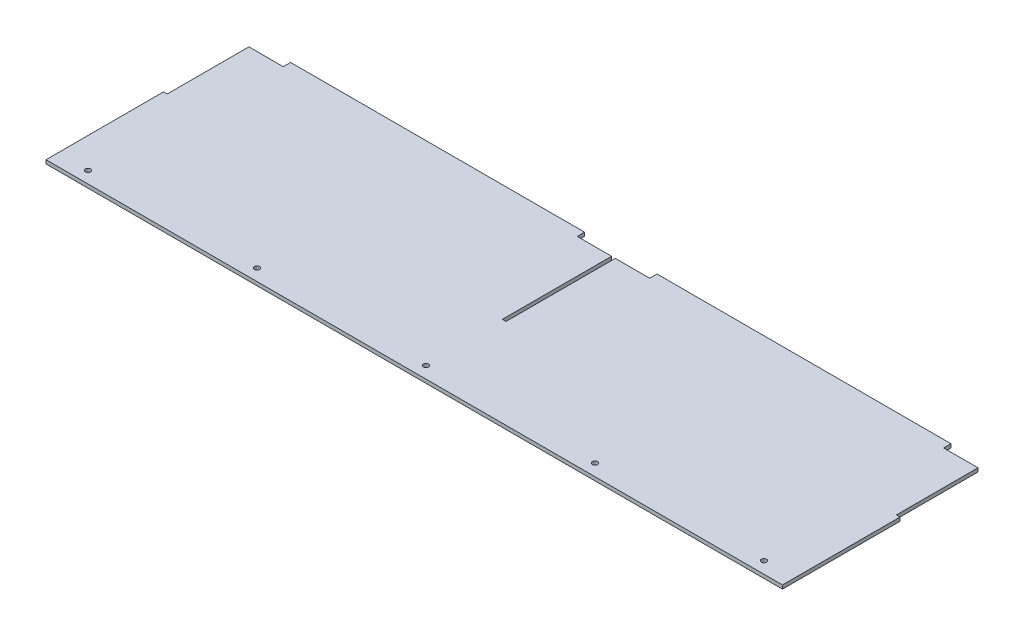
from build123d import *

# Parameters (mm, degrees)
SKETCH1_W           = 629.90984
SKETCH1_H           = 147.69846
BOSS_EXTRUDE1_DEPTH = 3.175
SKETCH3_W           = 254
SKETCH3_H           = 3.175
BOSS_EXTRUDE2_DEPTH = 6.35
SKETCH4_W           = 3.175
SKETCH4_H           = 188.732840052
CUT_EXTRUDE1_DEPTH  = 3.175
SKETCH9_W           = 3.175
SKETCH9_H           = 77.20584
BOSS_EXTRUDE4_DEPTH = 3.175
SKETCH10_W          = 636.25984
SKETCH10_H          = 24.39416
BOSS_EXTRUDE5_DEPTH = 3.175
SKETCH13_R          = 2.25
CUT_EXTRUDE3_DEPTH  = 652.56536379


with BuildPart() as part:
    # Sketch1 → Boss-Extrude1 (new body)
    with BuildSketch(Plane(origin=(0, 0, 0), x_dir=(1, 0, 0), z_dir=(0, 1, 0))):
        with Locations((314.95492, 73.84923)):
            Rectangle(SKETCH1_W, SKETCH1_H)
    extrude(amount=BOSS_EXTRUDE1_DEPTH)

    # Sketch3 → Boss-Extrude2 (add)
    with BuildSketch(Plane(origin=(0, 0, -147.69846), x_dir=(-1, 0, 0), z_dir=(0, 0, -1))):
        with Locations((-473.22613, 1.5875)):
            Rectangle(SKETCH3_W, SKETCH3_H)
        with Locations((-156.68371, 1.5875)):
            Rectangle(SKETCH3_W, SKETCH3_H)
    extrude(amount=BOSS_EXTRUDE2_DEPTH)

    # Sketch4 → Cut-Extrude1 (cut)
    with BuildSketch(Plane(origin=(0, 3.175, 0), x_dir=(1, 0, 0), z_dir=(0, 1, 0))):
        with Locations((314.95492, 147.69846)):
            Rectangle(SKETCH4_W, SKETCH4_H)
    extrude(amount=-CUT_EXTRUDE1_DEPTH, mode=Mode.SUBTRACT)

    # Sketch9 → Boss-Extrude4 (add, through all)
    with BuildSketch(Plane.XZ):
        with Locations((-1.5875, -38.60292)):
            Rectangle(SKETCH9_W, SKETCH9_H)
        with Locations((631.49734, -38.60292)):
            Rectangle(SKETCH9_W, SKETCH9_H)
    extrude(amount=-BOSS_EXTRUDE4_DEPTH)

    # Sketch10 → Boss-Extrude5 (add, through all)
    with BuildSketch(Plane(origin=(0, 3.175, 0), x_dir=(1, 0, 0), z_dir=(0, 1, 0))):
        with Locations((314.95492, -12.19708)):
            Rectangle(SKETCH10_W, SKETCH10_H)
    extrude(amount=-BOSS_EXTRUDE5_DEPTH)

    # Sketch13 → Cut-Extrude3 (cut, through all)
    with BuildSketch(Plane(origin=(0, 3.175, 0), x_dir=(1, 0, 0), z_dir=(0, 1, 0))):
        with Locations(Location((606.977733219, -14.23416, 0), (0, 0, 270))):
            Circle(SKETCH13_R)
        with Locations(Location((460.966326609, -14.23416, 0), (0, 0, 270))):
            Circle(SKETCH13_R)
        with Locations(Location((314.95492, -14.23416, 0), (0, 0, 270))):
            Circle(SKETCH13_R)
        with Locations(Location((168.943513391, -14.23416, 0), (0, 0, 270))):
            Circle(SKETCH13_R)
        with Locations(Location((22.932106781, -14.23416, 0), (0, 0, 270))):
            Circle(SKETCH13_R)
    extrude(amount=-CUT_EXTRUDE3_DEPTH, mode=Mode.SUBTRACT)


solid = part.part
